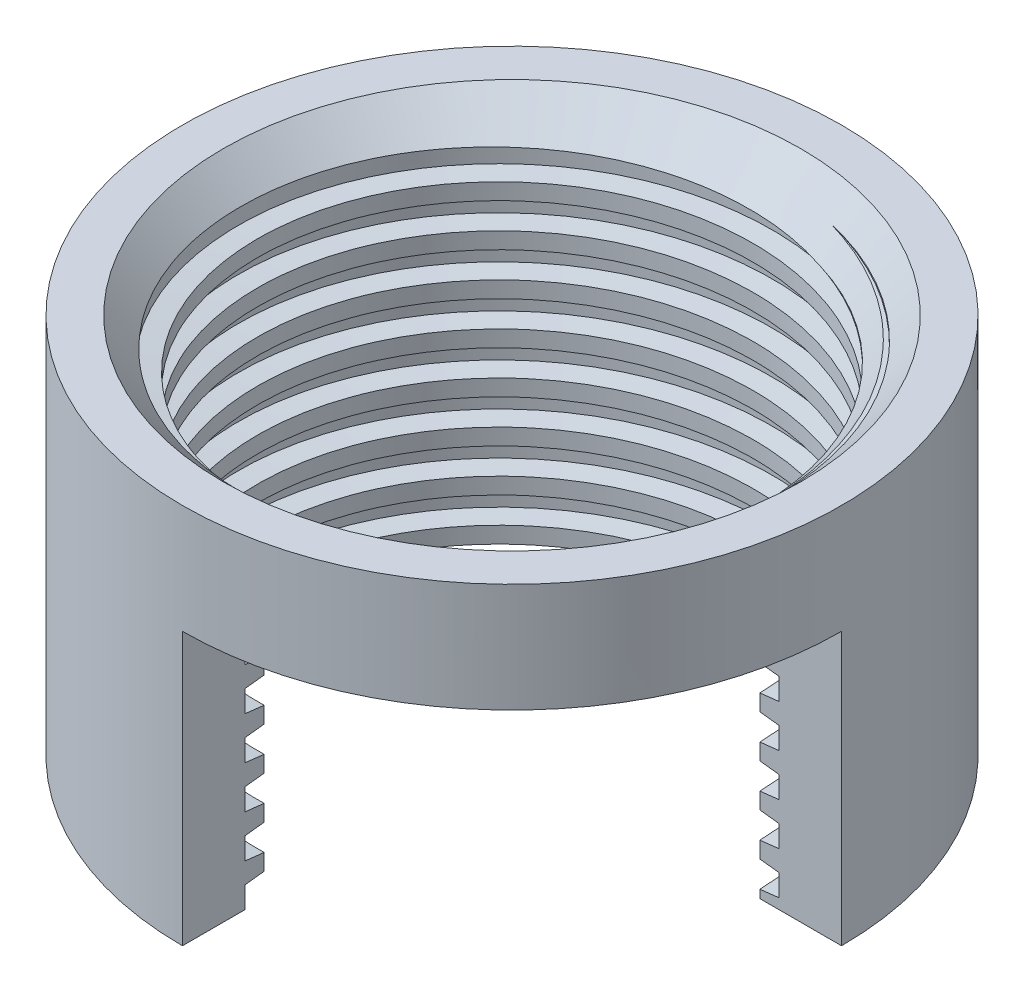
from build123d import *

# Parameters (mm, degrees)
SKETCH2_R           = 6.05
SKETCH2_R_2         = 4.55
BOSS_EXTRUDE1_DEPTH = 7
CUT_SWEEP1_PITCH    = 0.78
CUTOUT_DEPTH        = 5


with BuildPart() as part:
    # Sketch2 → Boss-Extrude1 (new body)
    with BuildSketch(Plane(origin=(0, 0, 0), x_dir=(1, 0, 0), z_dir=(0, 1, 0))):
        with Locations(Location((0, 0, 0), (0, 0, 270))):
            Circle(SKETCH2_R)
        with Locations(Location((0, 0, 0), (0, 0, 270))):
            Circle(SKETCH2_R_2, mode=Mode.SUBTRACT)
    extrude(amount=BOSS_EXTRUDE1_DEPTH)

    # Cut-Sweep1: arcs per turn and ends read off the stored shape
    # Cut-Sweep1: the profile of Sketch3 profile screwed along a right-hand helix through 10.5 turns, 8 arcs to a turn; built about Z, then put on its axis
    cut_sweep1_z = Axis((0, 0, 0), (0, 0, 1))
    cut_sweep1_corners = [(4.9, 0, -0.98), (4.9, 0, -0.58), (4.5497, 0, -0.539965714), (4.5497, 0, -1.020034286)]
    with BuildLine(mode=Mode.PRIVATE) as cut_sweep1_profile:
        Line(cut_sweep1_corners[0], cut_sweep1_corners[1])
        Line(cut_sweep1_corners[1], cut_sweep1_corners[2])
        Line(cut_sweep1_corners[2], cut_sweep1_corners[3])
        Line(cut_sweep1_corners[3], cut_sweep1_corners[0])
    cut_sweep1_cap = Face(cut_sweep1_profile.wire())
    cut_sweep1_turn_angles = [0, 22.5, 45, 67.5, 90, 112.5, 135, 157.5, 180, 202.5, 225, 247.5, 270, 292.5, 315, 337.5, 360]
    cut_sweep1_turn_weights = [1, 0.9238795325112867, 1, 0.9238795325112867, 1, 0.9238795325112867, 1, 0.9238795325112867, 1, 0.9238795325112867, 1, 0.9238795325112867, 1, 0.9238795325112867, 1, 0.9238795325112867, 1]
    cut_sweep1_turn_rails = [Edge.make_bspline([Vector(p[0], p[1], 0).rotate(cut_sweep1_z, cut_sweep1_turn_angles[k]) / cut_sweep1_turn_weights[k] + Vector(0, 0, p[2] + CUT_SWEEP1_PITCH * cut_sweep1_turn_angles[k] / 360) for k in range(17)], [0, 0, 0, 1, 1, 2, 2, 3, 3, 4, 4, 5, 5, 6, 6, 7, 7, 8, 8, 8], 2, cut_sweep1_turn_weights) for p in cut_sweep1_corners]
    cut_sweep1_turn_sides = [Face.make_surface_from_curves(cut_sweep1_turn_rails[p[0]], cut_sweep1_turn_rails[p[1]]) for p in [(0, 1), (1, 2), (2, 3), (3, 0)]]
    cut_sweep1_last_angles = [3600, 3622.5, 3645, 3667.5, 3690, 3712.5, 3735, 3757.5, 3780]
    cut_sweep1_last_weights = [1, 0.9238795325112867, 1, 0.9238795325112867, 1, 0.9238795325112867, 1, 0.9238795325112867, 1]
    cut_sweep1_last_rails = [Edge.make_bspline([Vector(p[0], p[1], 0).rotate(cut_sweep1_z, cut_sweep1_last_angles[k]) / cut_sweep1_last_weights[k] + Vector(0, 0, p[2] + CUT_SWEEP1_PITCH * cut_sweep1_last_angles[k] / 360) for k in range(9)], [0, 0, 0, 1, 1, 2, 2, 3, 3, 4, 4, 4], 2, cut_sweep1_last_weights) for p in cut_sweep1_corners]
    cut_sweep1_last_sides = [Face.make_surface_from_curves(cut_sweep1_last_rails[p[0]], cut_sweep1_last_rails[p[1]]) for p in [(0, 1), (1, 2), (2, 3), (3, 0)]]
    cut_sweep1 = Plane(origin=(0, 0, 0), x_dir=(-1, 0, 0), z_dir=(0, 1, 0)) * Solid(Shell([*[p.moved(Location((0, 0, CUT_SWEEP1_PITCH * i))) for i in range(10) for p in cut_sweep1_turn_sides], *cut_sweep1_last_sides, cut_sweep1_cap, cut_sweep1_cap.rotate(cut_sweep1_z, 3780).moved(Location((0, 0, CUT_SWEEP1_PITCH * 3780 / 360)))]))
    add(cut_sweep1, mode=Mode.SUBTRACT)

    # Sketch6 → cutout (cut)
    with BuildSketch(Plane(origin=(0, 0, 0), x_dir=(1, 0, 0), z_dir=(0, 1, 0))):
        with BuildLine():
            Line((0, 0), (7, 0))
            ThreePointArc((7, 0), (4.949747468, -4.949747468), (0, -7))
            Line((0, -7), (0, 0))
        make_face()
    extrude(amount=CUTOUT_DEPTH, mode=Mode.SUBTRACT)

    # Sketch7 → Cut-Revolve1 (revolve, cut)
    with BuildSketch(Plane.XY, mode=Mode.PRIVATE) as cut_revolve1_sk:
        Polygon((4.55, 7), (4.55, 6.25), (5.3, 7), align=None)
    revolve(cut_revolve1_sk.sketch.rotate(Axis((0, 7.807447703, 0), (0, -1, 0)), 90), axis=Axis((0, 7.807447703, 0), (0, -1, 0)), mode=Mode.SUBTRACT)


solid = part.part
